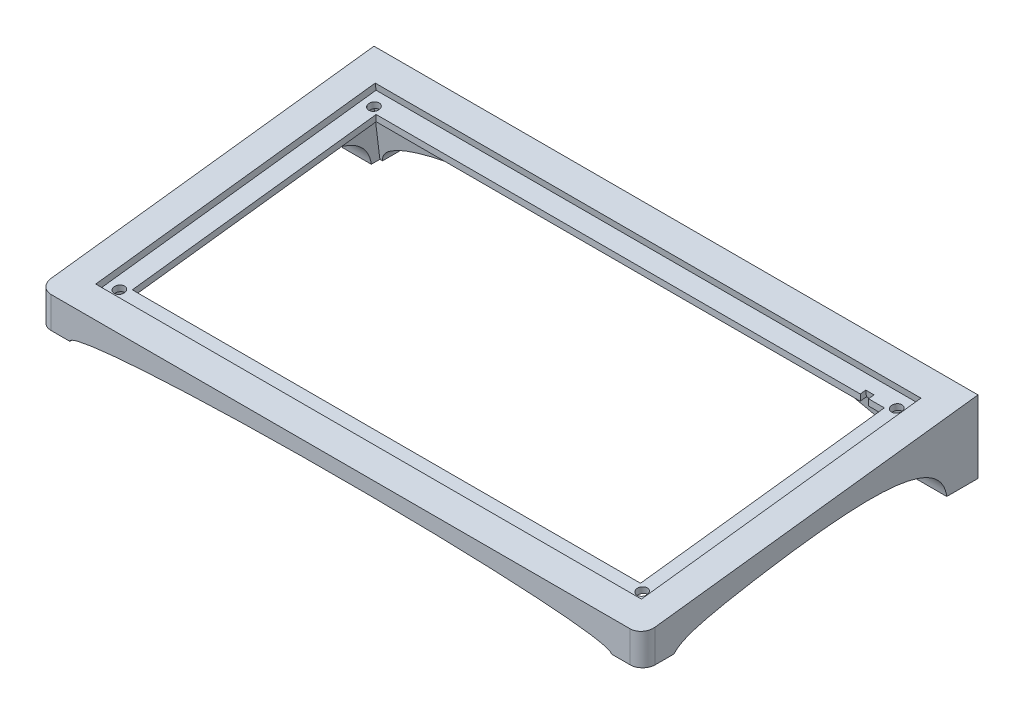
from build123d import *

# Parameters (mm, degrees)
SKETCH1_W            = 145
SKETCH1_H            = 80.5
SKETCH1_W_2          = 131
SKETCH1_H_2          = 67.1
BOSS_EXTRUDE1_DEPTH  = 17.38
SKETCH2_W            = 145.621836594
SKETCH2_H            = 81.229894902
CUT_EXTRUDE1_DEPTH   = 10.38
FILLET1_R            = 3
SKETCH5_W            = 131
SKETCH5_H            = 67.1
SKETCH5_W_2          = 122
SKETCH5_H_2          = 58.53632086
BOSS_EXTRUDE17_DEPTH = 17.38
SKETCH9_W            = 144.471640976
SKETCH9_H            = 84.136143584
CUT_EXTRUDE5_DEPTH   = 9.6
SKETCH6_W            = 131
SKETCH6_H            = 67.603909288
CUT_EXTRUDE6_DEPTH   = 1.6
SKETCH10_RX          = 65
SKETCH10_RY          = 4
CUT_EXTRUDE8_DEPTH   = 10.7
SKETCH12_RX          = 65
SKETCH12_RY          = 12.88
CUT_EXTRUDE9_DEPTH   = 10.7
CUT_EXTRUDE12_START  = -145
CUT_EXTRUDE12_DEPTH  = 145
CUT_EXTRUDE13_DEPTH  = 10
SKETCH21_W           = 131
SKETCH21_H           = 67.1
CUT_EXTRUDE14_DEPTH  = 30
SKETCH23_R           = 2.5
SKETCH23_R_2         = 3
CUT_EXTRUDE15_DEPTH  = 1
CUT_EXTRUDE17_DEPTH  = 10


# Read off the part's stored shape, not the designer's step: Cut-Extrude12
with BuildPart() as part:
    # Sketch1 → Boss-Extrude1 (new body)
    with BuildSketch(Plane(origin=(0, 0, 0), x_dir=(1, 0, 0), z_dir=(0, 1, 0))):
        Rectangle(SKETCH1_W, SKETCH1_H)
        Rectangle(SKETCH1_W_2, SKETCH1_H_2, mode=Mode.SUBTRACT)
    extrude(amount=BOSS_EXTRUDE1_DEPTH)

    # Sketch2 → Cut-Extrude1 (cut)
    with BuildSketch(Plane(origin=(0, 12.253191712, 1.504502764), x_dir=(-1, 0, 0), z_dir=(0, 0.9925461516413239, 0.12186934340513403))):
        with Locations((0.310918297, -1.453124341)):
            Rectangle(SKETCH2_W, SKETCH2_H)
    extrude(amount=CUT_EXTRUDE1_DEPTH, mode=Mode.SUBTRACT)

    # Fillet1
    fillet1_edges = [part.edges().sort_by_distance(p)[0] for p in [
        (72.5, 3.747921424, 40.25),
        (-72.5, 3.747921424, 40.25),
    ]]
    fillet(fillet1_edges, radius=FILLET1_R)

    # Sketch5 → Boss-Extrude17 (add)
    with BuildSketch(Plane(origin=(0, 0, 0), x_dir=(1, 0, 0), z_dir=(0, 1, 0))):
        Rectangle(SKETCH5_W, SKETCH5_H)
        Rectangle(SKETCH5_W_2, SKETCH5_H_2, mode=Mode.SUBTRACT)
    extrude(amount=BOSS_EXTRUDE17_DEPTH)

    # Sketch9 → Cut-Extrude5 (cut)
    with BuildSketch(Plane(origin=(0, 12.253191712, 1.504502764), x_dir=(1, 0, 0), z_dir=(0, 0.9925461516413236, 0.12186934340513404))):
        Rectangle(SKETCH9_W, SKETCH9_H)
    extrude(amount=CUT_EXTRUDE5_DEPTH, mode=Mode.SUBTRACT)

    # Sketch6 → Cut-Extrude6 (cut)
    with BuildSketch(Plane(origin=(0, 12.253191712, 1.504502764), x_dir=(-1, 0, 0), z_dir=(0, 0.9925461516413239, 0.12186934340513403))):
        with Locations((0, -1.515801317)):
            Rectangle(SKETCH6_W, SKETCH6_H)
    extrude(amount=-CUT_EXTRUDE6_DEPTH, mode=Mode.SUBTRACT)

    # Sketch10 → Cut-Extrude8 (cut)
    with BuildSketch(Plane.XY.offset(40.25)):
        with Locations((0, 0)):
            Ellipse(SKETCH10_RX, SKETCH10_RY)
    extrude(amount=-CUT_EXTRUDE8_DEPTH, mode=Mode.SUBTRACT)

    # Sketch12 → Cut-Extrude9 (cut)
    with BuildSketch(Plane(origin=(0, 0, -40.25), x_dir=(-1, 0, 0), z_dir=(0, 0, -1))):
        with Locations((0, 0)):
            Ellipse(SKETCH12_RX, SKETCH12_RY)
    extrude(amount=-CUT_EXTRUDE9_DEPTH, mode=Mode.SUBTRACT)

    # Cut-Extrude12 outline → Cut-Extrude12 (cut)
    with BuildSketch(Plane.ZY.offset(72.5).offset(CUT_EXTRUDE12_START)):
        with BuildLine():
            add(Edge.make_bspline(
                [(32.75, 0), (29.101844556, 4.008435343), (19.440941834, 4.451750453), (-1.339502668, 8.255924616), (-30.587167794, 14.944494998), (-32.75, 0)],
                knots=[0, 0, 0, 0, 0, 0, 1, 1, 1, 1, 1, 1], degree=5))
            Line((-32.75, 0), (32.75, 0))
        make_face()
    extrude(amount=CUT_EXTRUDE12_DEPTH, mode=Mode.SUBTRACT)

    # Sketch19 → Cut-Extrude13 (cut)
    with BuildSketch(Plane(origin=(0, 10.66511787, 1.309511815), x_dir=(1, 0, 0), z_dir=(0, 0.9925461516413238, 0.12186934340513403))):
        with BuildLine():
            ThreePointArc((61.5, 32.0425), (61.866116524, 31.158616524), (62.75, 30.7925))
            Line((62.75, 30.7925), (62.75, 32.0425))
            Line((62.75, 32.0425), (61.5, 32.0425))
        make_face()
        with BuildLine():
            Line((62.75, 32.0425), (62.75, 30.7925))
            ThreePointArc((62.75, 30.7925), (63.633883476, 31.158616524), (64, 32.0425))
            ThreePointArc((64, 32.0425), (62.75, 33.2925), (61.5, 32.0425))
            Line((61.5, 32.0425), (62.75, 32.0425))
        make_face()
        with BuildLine():
            ThreePointArc((64, -29.5425), (63.633883476, -28.658616524), (62.75, -28.2925))
            Line((62.75, -28.2925), (62.75, -29.5425))
            Line((62.75, -29.5425), (61.5, -29.5425))
            ThreePointArc((61.5, -29.5425), (62.75, -30.7925), (64, -29.5425))
        make_face()
        with BuildLine():
            Line((62.75, -29.5425), (62.75, -28.2925))
            ThreePointArc((62.75, -28.2925), (61.866116524, -28.658616524), (61.5, -29.5425))
            Line((61.5, -29.5425), (62.75, -29.5425))
        make_face()
        with BuildLine():
            ThreePointArc((-61.5, -29.5425), (-61.866116524, -28.658616524), (-62.75, -28.2925))
            Line((-62.75, -28.2925), (-62.75, -29.5425))
            Line((-62.75, -29.5425), (-61.5, -29.5425))
        make_face()
        with BuildLine():
            Line((-62.75, -29.5425), (-62.75, -28.2925))
            ThreePointArc((-62.75, -28.2925), (-63.633883476, -30.426383476), (-61.5, -29.5425))
            Line((-61.5, -29.5425), (-62.75, -29.5425))
        make_face()
        with BuildLine():
            ThreePointArc((-61.5, 32.0425), (-63.633883476, 32.926383476), (-62.75, 30.7925))
            Line((-62.75, 30.7925), (-62.75, 32.0425))
            Line((-62.75, 32.0425), (-61.5, 32.0425))
        make_face()
        with BuildLine():
            Line((-62.75, 32.0425), (-62.75, 30.7925))
            ThreePointArc((-62.75, 30.7925), (-61.866116524, 31.158616524), (-61.5, 32.0425))
            Line((-61.5, 32.0425), (-62.75, 32.0425))
        make_face()
    extrude(amount=-CUT_EXTRUDE13_DEPTH, mode=Mode.SUBTRACT)

    # Sketch21 → Cut-Extrude14 (cut)
    with BuildSketch(Plane(origin=(0, 9.176298642, 1.1267078), x_dir=(1, 0, 0), z_dir=(0, 0.9925461516413236, 0.12186934340513401))):
        with Locations((-0.141032576, 0.996407471)):
            Rectangle(SKETCH21_W, SKETCH21_H)
    extrude(amount=-CUT_EXTRUDE14_DEPTH, mode=Mode.SUBTRACT)

    # Sketch23 → Cut-Extrude15 (cut)
    with BuildSketch(Plane(origin=(0, 0, 0), x_dir=(-1, 0, 0), z_dir=(0, -1, 0))):
        with Locations(Location((-68.75, 36.5, 0), (0, 0, 90))):
            Circle(SKETCH23_R)
        with Locations(Location((-68.75, -36.524032163, 0), (0, 0, 90))):
            Circle(SKETCH23_R_2)
        with Locations(Location((68.75, -36.524032163, 0), (0, 0, 90))):
            Circle(SKETCH23_R)
        with Locations(Location((68.75, 36.5, 0), (0, 0, 90))):
            Circle(SKETCH23_R)
    extrude(amount=-CUT_EXTRUDE15_DEPTH, mode=Mode.SUBTRACT)

    # Sketch25 → Cut-Extrude17 (cut)
    with BuildSketch(Plane(origin=(0, 9.176298642, 1.1267078), x_dir=(1, 0, 0), z_dir=(0, -0.9925461516413238, -0.1218693434051341))):
        Polygon((57.22, -32.123128384), (57.22, -32.0425), (57.22, -30.623128384), (55.22, -30.623128384), (55.22, -32.123128384), align=None)
    extrude(amount=-CUT_EXTRUDE17_DEPTH, mode=Mode.SUBTRACT)


solid = part.part
